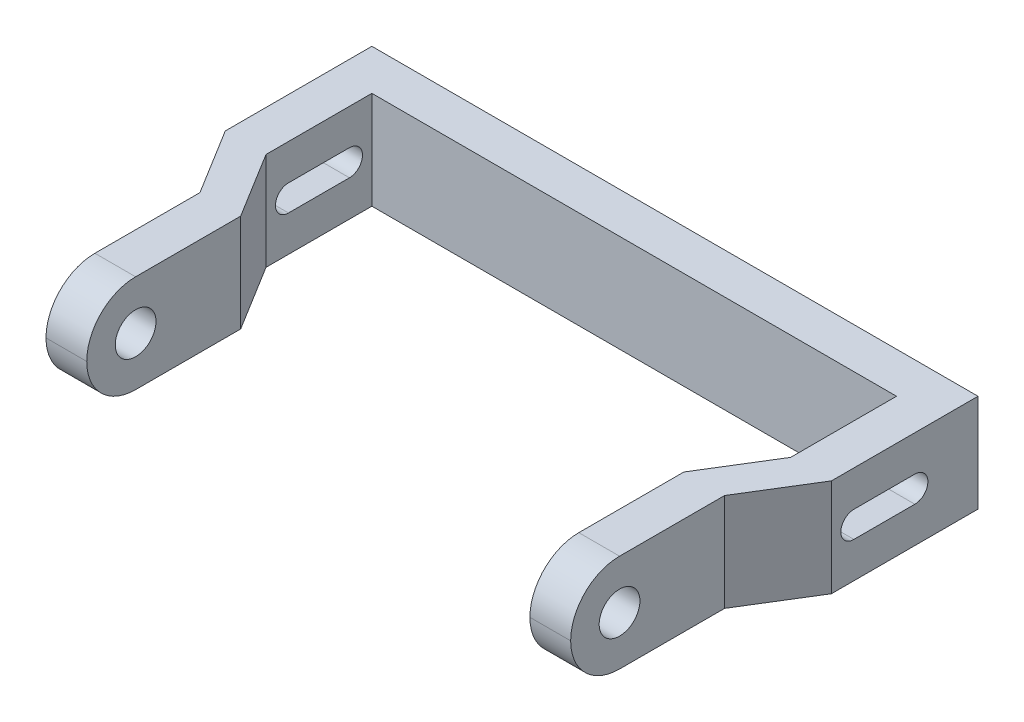
from build123d import *

# Parameters (mm, degrees)
BOSS_EXTRU_1_DEPTH      = 12
ESQUISSE2_R             = 2.5
ENL_V_MAT_EXTRU_1_DEPTH = 84.578466126
ENL_V_MAT_EXTRU_2_DEPTH = 88.774483764
CONG_1_R                = 6


with BuildPart() as part:
    # Esquisse1 → Boss.-Extru.1 (new body)
    with BuildSketch(Plane(origin=(0, 0, 0), x_dir=(1, 0, 0), z_dir=(0, 1, 0))):
        Polygon((-32.2, 27.00676783), (-32.2, 18.895405671), (-37.2, 27.00676783), (-37.2, 45), (37.2, 45), (37.2, 27.00676783), (32.2, 18.895405671), (32.2, 0), (27.2, 0), (27.2, 18.895405671), (32.2, 27.00676783), (32.2, 40), (-32.2, 40), align=None)
        Polygon((-32.2, 27.00676783), (-27.2, 18.895405671), (-27.2, 0), (-32.2, 0), (-32.2, 18.895405671), align=None)
    extrude(amount=BOSS_EXTRU_1_DEPTH)

    # Esquisse2 → Enlèv. mat.-Extru.1 (cut, through all)
    with BuildSketch(Plane.ZY.offset(32.2)):
        with Locations((-6, 6)):
            Circle(ESQUISSE2_R)
    extrude(amount=-ENL_V_MAT_EXTRU_1_DEPTH, mode=Mode.SUBTRACT)

    # Esquisse5 → Enlèv. mat.-Extru.2 (cut, through all)
    with BuildSketch(Plane.ZY.offset(37.2)):
        with BuildLine():
            Line((-37.247636958, 7.6), (-29.765898702, 7.6))
            ThreePointArc((-29.765898702, 7.6), (-28.165898702, 6), (-29.765898702, 4.4))
            Line((-29.765898702, 4.4), (-37.247636958, 4.4))
            ThreePointArc((-37.247636958, 4.4), (-38.847636958, 6), (-37.247636958, 7.6))
        make_face()
    extrude(amount=-ENL_V_MAT_EXTRU_2_DEPTH, mode=Mode.SUBTRACT)

    # Congé1
    cong_1_edges = [part.edges().sort_by_distance(p)[0] for p in [
        (-29.7, 0, 0),
        (-29.7, 12, 0),
        (29.7, 0, 0),
        (29.7, 12, 0),
    ]]
    fillet(cong_1_edges, radius=CONG_1_R - 0.0001)  # a hair under: the kernel refuses the full size


solid = part.part
